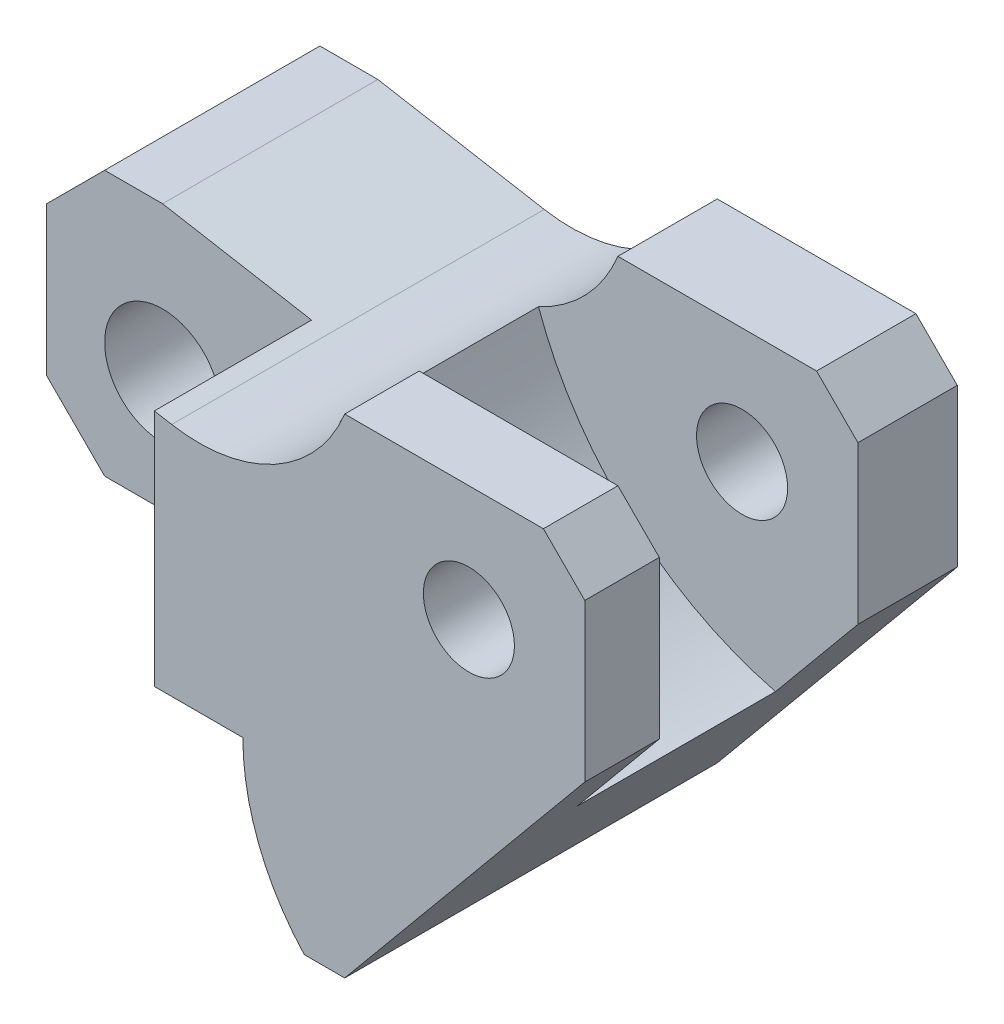
from build123d import *

# Parameters (mm, degrees)
SKETCH1_W           = 26
SKETCH1_H           = 32
BOSS_EXTRUDE1_DEPTH = 32
SKETCH2_W           = 45
SKETCH2_H           = 40
SKETCH2_H_2         = 19
BOSS_EXTRUDE2_DEPTH = 52
CHAMFER1_SIZE       = 7
SKETCH3_R           = 7
CUT_EXTRUDE1_DEPTH  = 71.569115058
CHAMFER2_SIZE       = 5
SPLIT1_DEPTH        = 45
CUT_EXTRUDE2_DEPTH  = 52
CUT_EXTRUDE7_DEPTH  = 80.555012413
SKETCH8_R           = 41
CUT_EXTRUDE8_DEPTH  = 24
SKETCH9_R           = 5.5
CUT_EXTRUDE9_DEPTH  = 80.555012413


# Read off the part's stored shape, not the designer's step: Split1
with BuildPart() as part:
    # Sketch1 → Boss-Extrude1 (new body)
    with BuildSketch(Plane(origin=(0, 0, 0), x_dir=(0, 0, -1), z_dir=(1, 0, 0))):
        with Locations((-13, 16)):
            Rectangle(SKETCH1_W, SKETCH1_H)
    extrude(amount=-BOSS_EXTRUDE1_DEPTH)

    # Sketch2 → Boss-Extrude2 (add)
    with BuildSketch(Plane(origin=(0, 0, 0), x_dir=(0, 0, -1), z_dir=(1, 0, 0))):
        with Locations((-22.5, 20)):
            Rectangle(SKETCH2_W, SKETCH2_H)
        with Locations((-22.5, -9.5)):
            Rectangle(SKETCH2_W, SKETCH2_H_2)
    extrude(amount=BOSS_EXTRUDE2_DEPTH)

    # Chamfer1
    chamfer1_edges = [part.edges().sort_by_distance(p)[0] for p in [
        (-32, 0, 13),
        (-32, 32, 13),
    ]]
    chamfer(chamfer1_edges, length=CHAMFER1_SIZE)

    # Sketch3 → Cut-Extrude1 (cut, through all)
    with BuildSketch(Plane.XY.offset(26)):
        with Locations((-18, 14)):
            Circle(SKETCH3_R)
    extrude(amount=-CUT_EXTRUDE1_DEPTH, mode=Mode.SUBTRACT)

    # Chamfer2
    chamfer2_edges = [part.edges().sort_by_distance(p)[0] for p in [
        (52, 40, 22.5),
    ]]
    chamfer(chamfer2_edges, length=CHAMFER2_SIZE)

    # Split1 outline → Split1 (cut)
    with BuildSketch(Plane.XY):
        with BuildLine():
            ThreePointArc((2.104042352, 28.455114912), (14.591637328, 30.535902458), (23, 40))
            Line((23, 40), (0, 40))
            Line((0, 40), (0, 32))
            Line((0, 32), (-18, 32))
            Line((-18, 32), (2.104042352, 28.455114912))
        make_face()
    extrude(amount=SPLIT1_DEPTH, mode=Mode.SUBTRACT)

    # Sketch6 → Cut-Extrude2 (cut)
    with BuildSketch(Plane.XY.offset(45)):
        Polygon((52, -19), (52, 16), (23, -19), align=None)
    extrude(amount=-CUT_EXTRUDE2_DEPTH, mode=Mode.SUBTRACT)

    # Sketch7 → Cut-Extrude7 (cut, through all)
    with BuildSketch(Plane.XY.offset(45)):
        with BuildLine():
            ThreePointArc((18.113465426, -19), (12.616803089, -10.198093068), (10.696969697, 0))
            Line((10.696969697, 0), (0, 0))
            Line((0, 0), (0, -19))
            Line((0, -19), (18.113465426, -19))
        make_face()
    extrude(amount=-CUT_EXTRUDE7_DEPTH, mode=Mode.SUBTRACT)

    # Sketch8 → Cut-Extrude8 (cut)
    with BuildSketch(Plane.XY.offset(12)):
        with Locations((52, 43.758742169)):
            Circle(SKETCH8_R)
    extrude(amount=CUT_EXTRUDE8_DEPTH, mode=Mode.SUBTRACT)

    # Sketch9 → Cut-Extrude9 (cut, through all)
    with BuildSketch(Plane.XY.offset(45)):
        with Locations((38, 26)):
            Circle(SKETCH9_R)
    extrude(amount=-CUT_EXTRUDE9_DEPTH, mode=Mode.SUBTRACT)


solid = part.part
